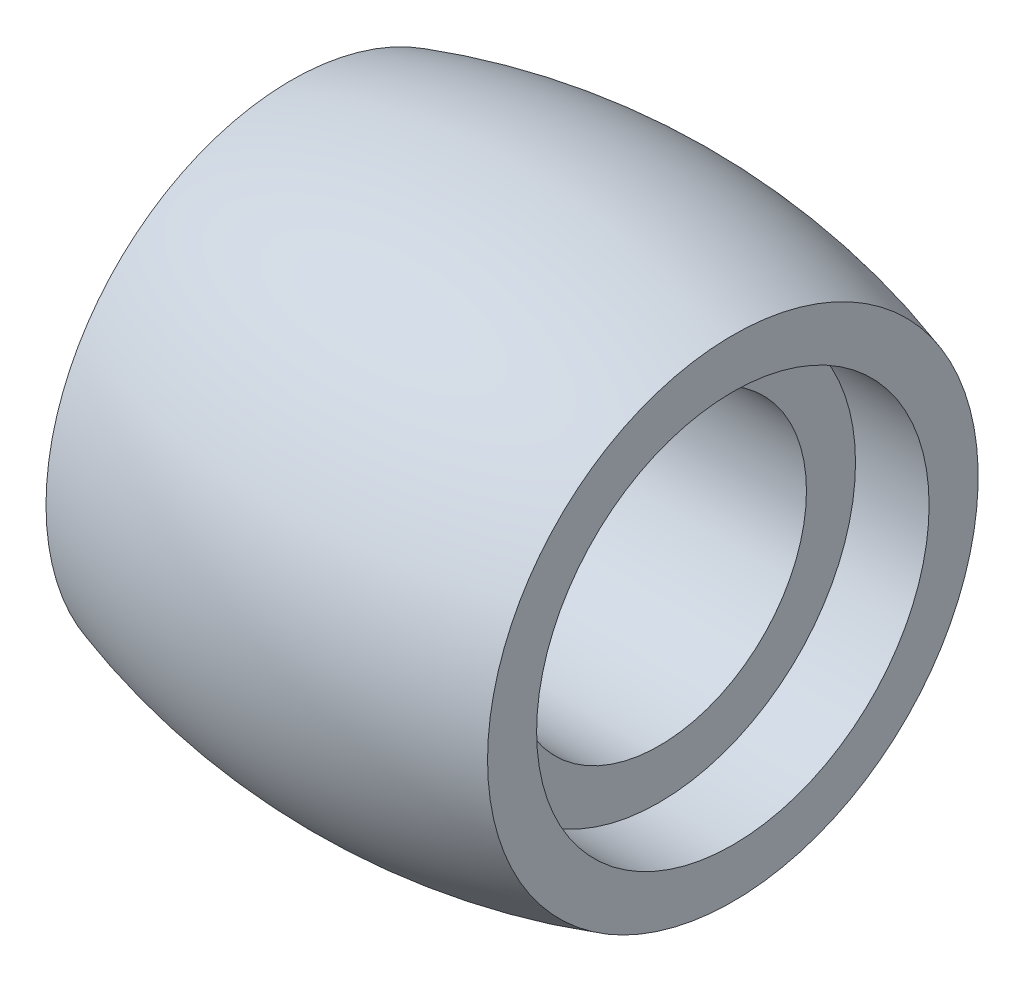
from build123d import *


with BuildPart() as part:
    # Sketch2 → Revolve1 (revolve)
    with BuildSketch(Plane.XY):
        with BuildLine():
            Line((-3, 3), (3, 3))
            Line((3, 3), (3, 4))
            Line((3, 4), (4.5, 4))
            Line((4.5, 4), (4.5, 5))
            ThreePointArc((4.5, 5), (0, 5.690911979), (-4.5, 5))
            Line((-4.5, 5), (-4.5, 4))
            Line((-4.5, 4), (-3, 4))
            Line((-3, 4), (-3, 3))
        make_face()
    revolve(axis=Axis((-8.91796875, 0, 0), (1, 0, 0)))


solid = part.part
